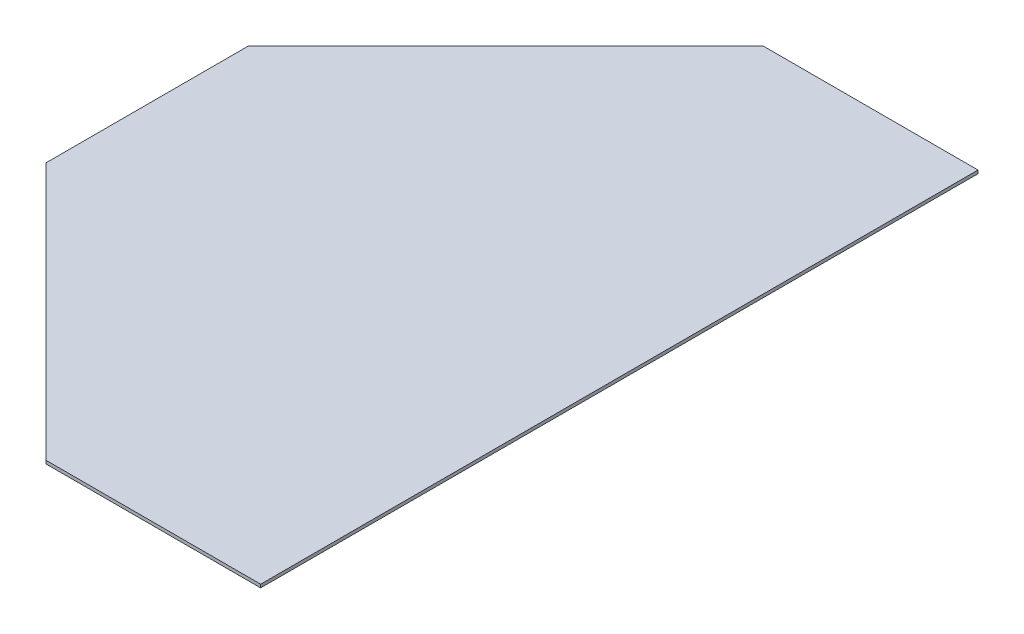
from build123d import *

# Parameters (mm, degrees)
SKETCH1_W           = 440
SKETCH1_H           = 668.38
BOSS_EXTRUDE1_DEPTH = 3
CUT_EXTRUDE1_DEPTH  = 801.212986898


with BuildPart() as part:
    # Sketch1 → Boss-Extrude1 (new body)
    with BuildSketch(Plane(origin=(0, 0, 0), x_dir=(1, 0, 0), z_dir=(0, 1, 0))):
        with Locations((220, 334.19)):
            Rectangle(SKETCH1_W, SKETCH1_H)
    extrude(amount=BOSS_EXTRUDE1_DEPTH)

    # Sketch2 → Cut-Extrude1 (cut, through all)
    with BuildSketch(Plane.XZ):
        Polygon((240, 0), (0, -240), (0, 0), align=None)
        Polygon((0, -428.38), (240, -668.38), (0, -668.38), align=None)
    extrude(amount=-CUT_EXTRUDE1_DEPTH, mode=Mode.SUBTRACT)


solid = part.part
